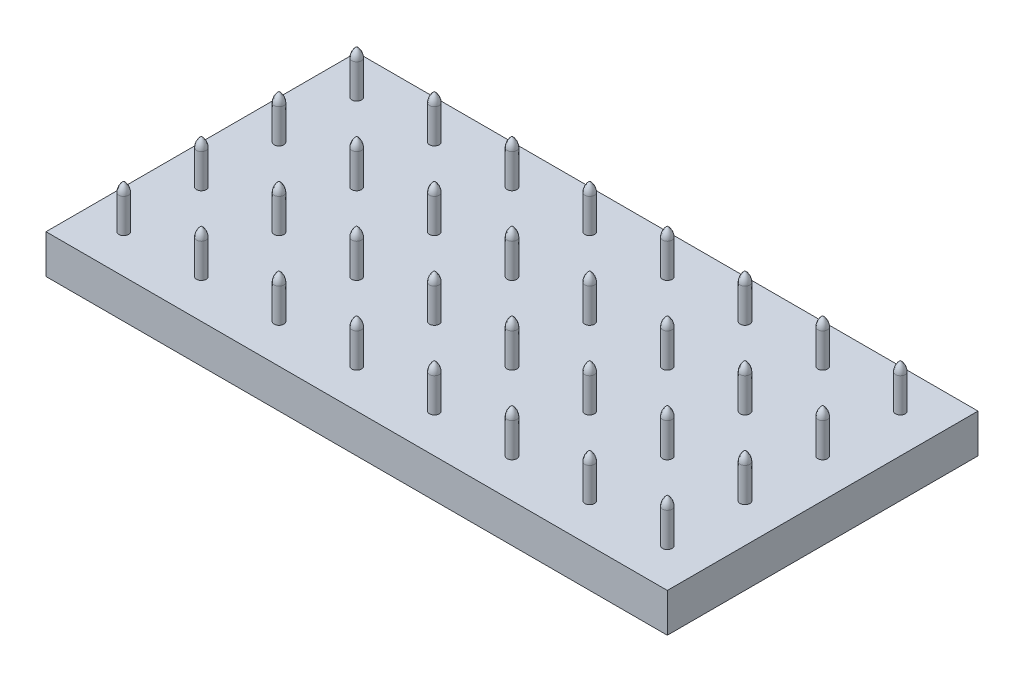
from build123d import *

# Parameters (mm, degrees)
SKETCH1_W            = 101.6
SKETCH1_H            = 50.8
BOSS_EXTRUDE1_DEPTH  = 6.35
SKETCH2_R            = 0.79375
BOSS_EXTRUDE2_DEPTH  = 5.55625
LPATTERN1_COUNT      = 8
LPATTERN1_PITCH      = 12.7
LPATTERN1_COUNT_DIR2 = 4
LPATTERN1_PITCH_DIR2 = 12.7


with BuildPart() as part:
    # Sketch1 → Boss-Extrude1 (new body)
    with BuildSketch(Plane(origin=(0, 0, 0), x_dir=(1, 0, 0), z_dir=(0, 1, 0))):
        Rectangle(SKETCH1_W, SKETCH1_H)
    extrude(amount=BOSS_EXTRUDE1_DEPTH)

    # Sketch2 → Boss-Extrude2 (add)
    with BuildSketch(Plane(origin=(0, 6.35, 0), x_dir=(1, 0, 0), z_dir=(0, 1, 0))):
        with Locations((-44.45, 19.05)):
            Circle(SKETCH2_R)
    boss_extrude2 = extrude(amount=BOSS_EXTRUDE2_DEPTH)

    # Sketch12 → Revolve1 (revolve)
    with BuildSketch(Plane(origin=(-44.45, 0, 0), x_dir=(0, 0, -1), z_dir=(1, 0, 0))):
        with BuildLine():
            Line((19.05, 11.90625), (19.05, 13.49375))
            ThreePointArc((19.05, 13.49375), (18.474355829, 12.789384585), (18.25625, 11.90625))
            Line((18.25625, 11.90625), (19.05, 11.90625))
        make_face()
    revolve1 = revolve(axis=Axis((-44.45, 6.35, -19.05), (0, 1, 0)))

    # LPattern1: Boss-Extrude2, Revolve1 8 × 4
    with Locations(*[(i * LPATTERN1_PITCH, 0, j * LPATTERN1_PITCH_DIR2) for i in range(LPATTERN1_COUNT) for j in range(LPATTERN1_COUNT_DIR2) if (i, j) != (0, 0)]):
        add(boss_extrude2)
        add(revolve1)


solid = part.part
